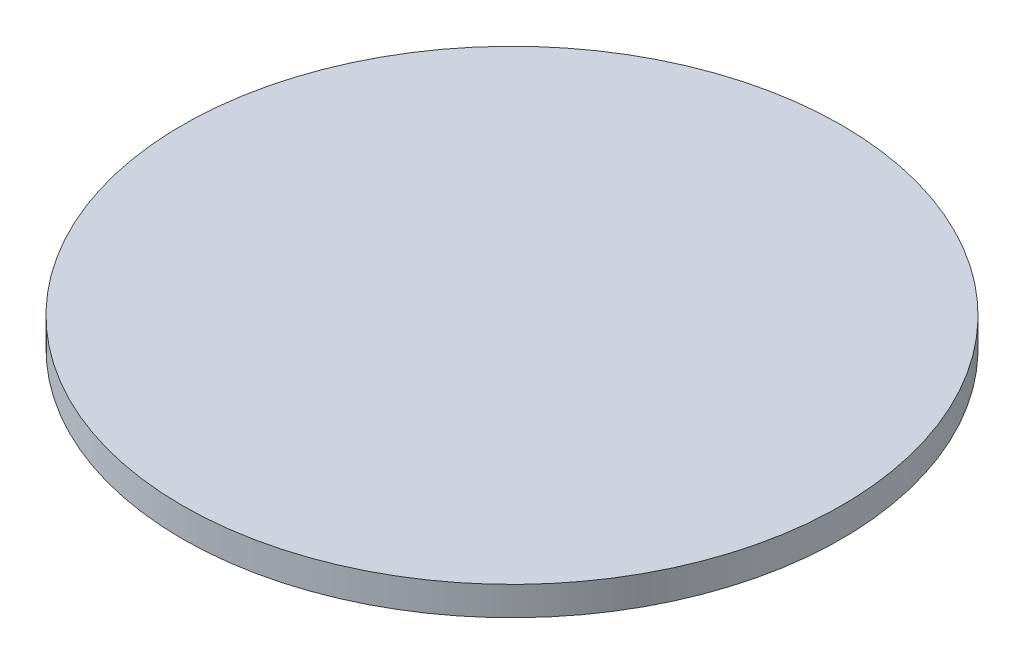
from build123d import *


with BuildPart() as part:
    # Sketch1 → Revolve1 (revolve)
    with BuildSketch(Plane.XY):
        with BuildLine():
            Line((0, 0), (68.5, 0))
            Line((68.5, 0), (68.5, -6))
            Line((68.5, -6), (66.5, -6))
            Line((66.5, -6), (66.5, -3))
            Line((66.5, -3), (62.351595203, -3))
            ThreePointArc((62.351595203, -3), (60, -2.3), (57.648404797, -3))
            Line((57.648404797, -3), (53.5, -3))
            Line((53.5, -3), (53.5, -6))
            Line((53.5, -6), (50.5, -6))
            Line((50.5, -6), (50.5, -3))
            Line((50.5, -3), (6, -3))
            Line((6, -3), (6, -5))
            Line((6, -5), (0, -5))
            Line((0, -5), (0, 0))
        make_face()
    revolve(axis=Axis((0, -5, 0), (0, 1, 0)))


solid = part.part
